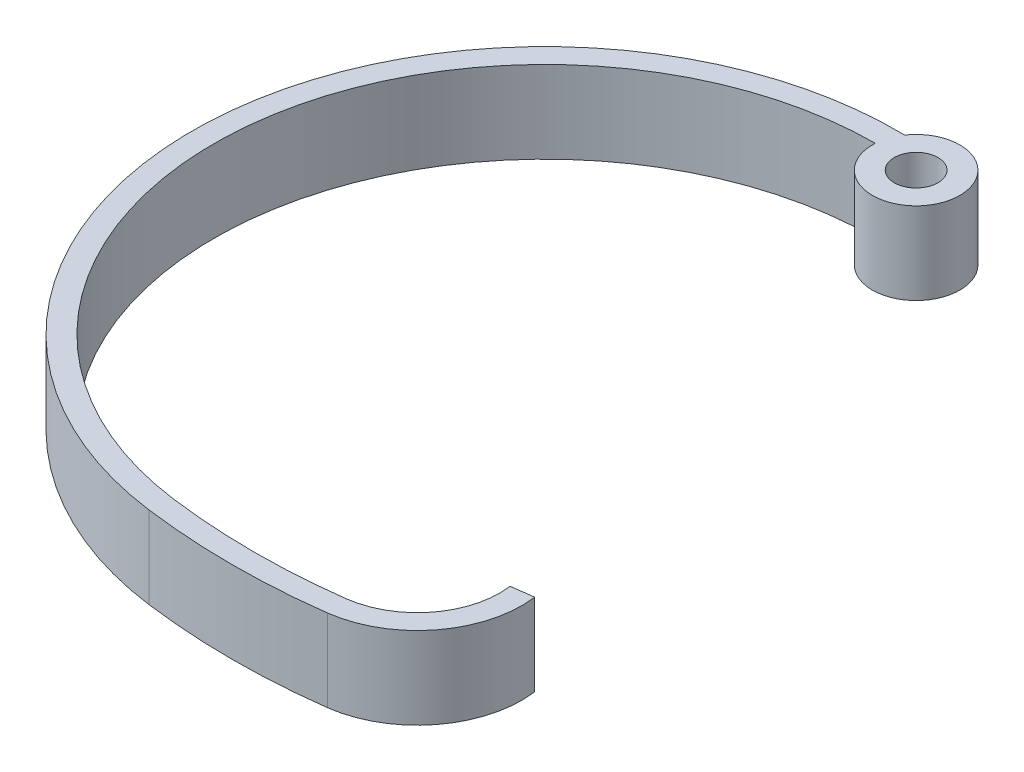
from build123d import *

# Parameters (mm, degrees)
ESQUISSE1_R        = 4
BOSS_EXTRU_3_DEPTH = 15
ESQUISSE7_W        = 1.25
ESQUISSE7_H        = 8


with BuildPart() as part:
    # Esquisse1 → Boss.-Extru.3 (new body)
    with BuildSketch(Plane(origin=(0, 0, 0), x_dir=(1, 0, 0), z_dir=(0, 1, 0))):
        with BuildLine():
            Line((28.782593777, -103.004094799), (32.748537618, -102.483240259))
            ThreePointArc((32.748537618, -102.483240259), (28.95558022, -116.620920997), (16.276704404, -123.93574502))
            ThreePointArc((16.276704404, -123.93574502), (-0.019702968, -124.999998447), (-16.315774028, -123.930607672))
            ThreePointArc((-16.315774028, -123.930607672), (-72.213491451, -55.122614189), (-6.611130296, 4.504770384))
            ThreePointArc((-6.611130296, 4.504770384), (7.564619357, -2.603177672), (-7.983242995, 0.517524181))
            ThreePointArc((-7.983242995, 0.517524181), (-68.270109781, -56.068637494), (-15.793669259, -119.964828226))
            ThreePointArc((-15.793669259, -119.964828226), (-0.019072473, -120.999998497), (15.755849863, -119.96980118))
            ThreePointArc((15.755849863, -119.96980118), (25.782934659, -114.184874991), (28.782593777, -103.004094799))
        make_face()
        Circle(ESQUISSE1_R, mode=Mode.SUBTRACT)
    extrude(amount=BOSS_EXTRU_3_DEPTH)

    # Esquisse7 → Trou taraudé M3x0.51 (revolve, cut)
    with BuildSketch(Plane(origin=(-1, 7.5, 0), x_dir=(0, -1, 0), z_dir=(1, 0, 0))):
        with Locations((0.625, 4)):
            Rectangle(ESQUISSE7_W, ESQUISSE7_H)
    revolve(axis=Axis((-1, 7.5, 6.35), (0, 0, -1)), mode=Mode.SUBTRACT)


solid = part.part
